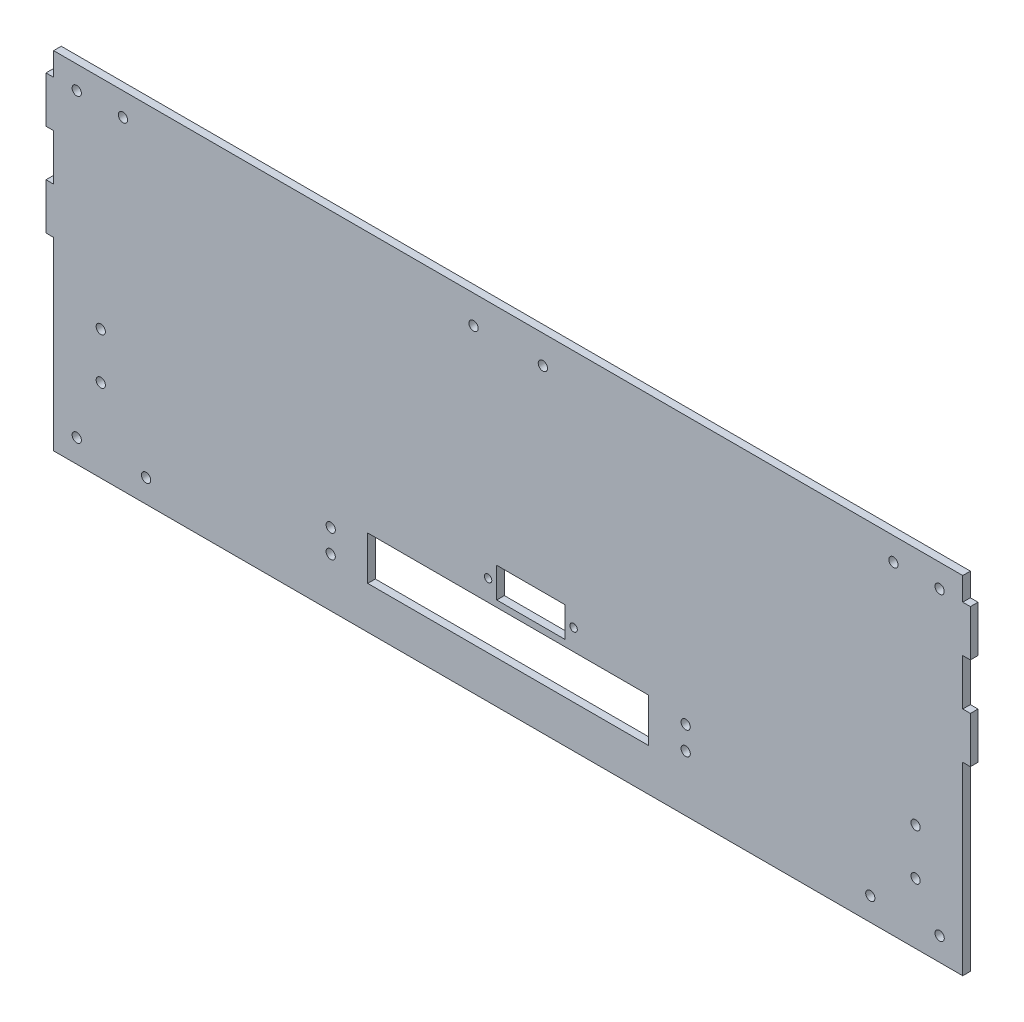
from build123d import *

# Parameters (mm, degrees)
SKETCH1_W           = 393.4
SKETCH1_H           = 150
BOSS_EXTRUDE1_DEPTH = 3.3
SKETCH2_R           = 2
CUT_EXTRUDE1_DEPTH  = 257.520622953
SKETCH3_R           = 2
CUT_EXTRUDE2_DEPTH  = 4
SKETCH4_R           = 2
CUT_EXTRUDE3_DEPTH  = 4
SKETCH6_W           = 29.5
SKETCH6_H           = 13
SKETCH6_W_2         = 121.579447476
SKETCH6_H_2         = 18.9
CUT_EXTRUDE4_DEPTH  = 10
SKETCH7_R           = 2
SKETCH7_R_2         = 1.6
CUT_EXTRUDE5_DEPTH  = 10
SKETCH8_W           = 3.3
SKETCH8_H           = 20
SKETCH8_H_2         = 19.969591437
BOSS_EXTRUDE2_DEPTH = 3.3


with BuildPart() as part:
    # Sketch1 → Boss-Extrude1 (new body)
    with BuildSketch(Plane.XY):
        with Locations((27, -50.5)):
            Rectangle(SKETCH1_W, SKETCH1_H)
    extrude(amount=BOSS_EXTRUDE1_DEPTH)

    # Sketch2 → Cut-Extrude1 (cut, through all)
    with BuildSketch(Plane(origin=(0, 0, 0), x_dir=(-1, 0, 0), z_dir=(0, 0, -1))):
        with Locations((-183.7, -115.5)):
            Circle(SKETCH2_R)
        with Locations((-213.7, -115.5)):
            Circle(SKETCH2_R)
        with Locations((129.7, -115.5)):
            Circle(SKETCH2_R)
        with Locations((159.7, -115.5)):
            Circle(SKETCH2_R)
    extrude(amount=-CUT_EXTRUDE1_DEPTH, mode=Mode.SUBTRACT)

    # Sketch3 → Cut-Extrude2 (cut)
    with BuildSketch(Plane.XY.offset(3.3)):
        with Locations((-159.7, 14.5)):
            Circle(SKETCH3_R)
        with Locations((-139.7, 14.5)):
            Circle(SKETCH3_R)
        with Locations((193.7, 14.5)):
            Circle(SKETCH3_R)
        with Locations((213.7, 14.5)):
            Circle(SKETCH3_R)
    extrude(amount=-CUT_EXTRUDE2_DEPTH, mode=Mode.SUBTRACT)

    # Sketch4 → Cut-Extrude3 (cut)
    with BuildSketch(Plane.XY.offset(3.3)):
        with Locations((12, 12.25)):
            Circle(SKETCH4_R)
        with Locations((42, 12.25)):
            Circle(SKETCH4_R)
    extrude(amount=-CUT_EXTRUDE3_DEPTH, mode=Mode.SUBTRACT)

    # Sketch6 → Cut-Extrude4 (cut)
    with BuildSketch(Plane(origin=(0, 0, 0), x_dir=(-1, 0, 0), z_dir=(0, 0, -1))):
        with Locations((-36.8, -79)):
            Rectangle(SKETCH6_W, SKETCH6_H)
        with Locations((-27, -97.742382112)):
            Rectangle(SKETCH6_W_2, SKETCH6_H_2)
    extrude(amount=-CUT_EXTRUDE4_DEPTH, mode=Mode.SUBTRACT)

    # Sketch7 → Cut-Extrude5 (cut)
    with BuildSketch(Plane.XY.offset(3.3)):
        with Locations((-149.298074337, -69.681790876)):
            Circle(SKETCH7_R)
        with Locations((-149.298074337, -89.681790876)):
            Circle(SKETCH7_R)
        with Locations((-49.797853771, -104.242382112)):
            Circle(SKETCH7_R)
        with Locations((-49.797853771, -94.242382112)):
            Circle(SKETCH7_R)
        with Locations((18.3, -79.226876468)):
            Circle(SKETCH7_R_2)
        with Locations((55.3, -79.226876468)):
            Circle(SKETCH7_R_2)
        with Locations((103.797853771, -91.242382112)):
            Circle(SKETCH7_R)
        with Locations((103.797853771, -101.242382112)):
            Circle(SKETCH7_R)
        with Locations((203.298074337, -79.2)):
            Circle(SKETCH7_R)
        with Locations((203.298074337, -99.2)):
            Circle(SKETCH7_R)
    extrude(amount=-CUT_EXTRUDE5_DEPTH, mode=Mode.SUBTRACT)

    # Sketch8 → Boss-Extrude2 (add)
    with BuildSketch(Plane.XY.offset(3.3)):
        with Locations((-171.35, 4.5)):
            Rectangle(SKETCH8_W, SKETCH8_H)
        with Locations((-171.35, -35.515204282)):
            Rectangle(SKETCH8_W, SKETCH8_H_2)
        with Locations((225.35, -35.515204282)):
            Rectangle(SKETCH8_W, SKETCH8_H_2)
        with Locations((225.35, 4.5)):
            Rectangle(SKETCH8_W, SKETCH8_H)
    extrude(amount=-BOSS_EXTRUDE2_DEPTH)


solid = part.part
